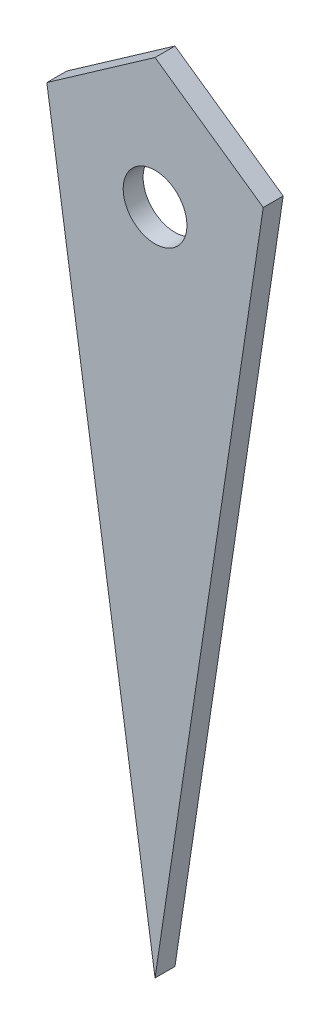
from build123d import *

# Parameters (mm, degrees)
T_LE_DE_BASE_PLI_E1_DEPTH = 10
ENL_V_MAT_EXTRU_1_DEPTH   = 405.598566483
ESQUISSE7_R               = 16
ENL_V_MAT_EXTRU_2_DEPTH   = 10


# Sheet-metal steps are written as plain solids
with BuildPart() as part:
    # Esquisse1 → Tôle de base pliée1 (new body)
    with BuildSketch(Plane.XY):
        Polygon((0, 0), (-60, 400), (60, 400), align=None)
    extrude(amount=-T_LE_DE_BASE_PLI_E1_DEPTH)

    # Esquisse6 → Enlèv. mat.-Extru.1 (cut, through all)
    with BuildSketch(Plane(origin=(0, 0, -10), x_dir=(-1, 0, 0), z_dir=(0, 0, -1))):
        Polygon((60, 400), (0, 400), (54.297112843, 361.980752285), align=None)
        Polygon((-54.297112843, 361.980752285), (0, 400), (-60, 400), align=None)
    extrude(amount=-ENL_V_MAT_EXTRU_1_DEPTH, mode=Mode.SUBTRACT)

    # Esquisse7 → Enlèv. mat.-Extru.2 (cut)
    with BuildSketch(Plane(origin=(0, 0, -10), x_dir=(-1, 0, 0), z_dir=(0, 0, -1))):
        with Locations((0, 335)):
            Circle(ESQUISSE7_R)
    extrude(amount=-ENL_V_MAT_EXTRU_2_DEPTH, mode=Mode.SUBTRACT)


solid = part.part
